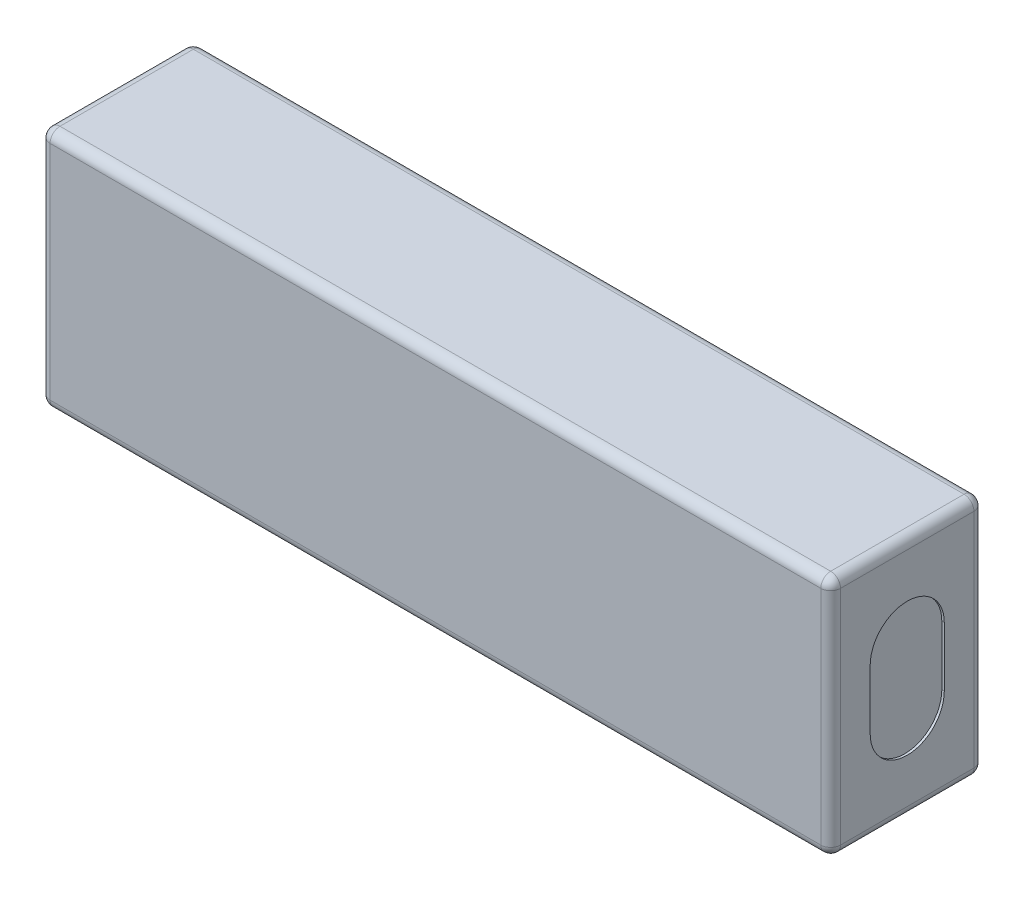
from build123d import *

# Parameters (mm, degrees)
ESBO_O1_W                = 160
ESBO_O1_H                = 49
RESSALTO_EXTRUS_O1_DEPTH = 15.5
CORTE_EXTRUS_O1_DEPTH    = 0.5
FILETE1_R                = 2


with BuildPart() as part:
    # Esboço1 → Ressalto-extrusão1 (new, symmetric)
    with BuildSketch(Plane.XY):
        Rectangle(ESBO_O1_W, ESBO_O1_H)
    extrude(amount=RESSALTO_EXTRUS_O1_DEPTH, both=True)

    # Esboço2 → Corte-extrusão1 (cut)
    with BuildSketch(Plane(origin=(80, 0, 0), x_dir=(0, 0, -1), z_dir=(1, 0, 0))):
        with BuildLine():
            Line((7.5, 6), (7.5, -6))
            ThreePointArc((7.5, -6), (0, -13.5), (-7.5, -6))
            Line((-7.5, -6), (-7.5, 6))
            ThreePointArc((-7.5, 6), (0, 13.5), (7.5, 6))
        make_face()
    corte_extrus_o1 = extrude(amount=-CORTE_EXTRUS_O1_DEPTH, mode=Mode.SUBTRACT)

    # Espelhar1: Corte-extrusão1 across plane
    add(corte_extrus_o1.mirror(Plane(origin=(0, 0, 0), x_dir=(0, 0, 1), z_dir=(1, 0, 0))), mode=Mode.SUBTRACT)

    # Filete1
    filete1_edges = [part.edges().sort_by_distance(p)[0] for p in [
        (-80, -24.5, 0),
        (80, -24.5, 0),
        (-80, 0, -15.5),
        (0, -24.5, -15.5),
        (80, 0, -15.5),
        (80, 24.5, 0),
        (-80, 24.5, 0),
        (0, 24.5, -15.5),
        (0, -24.5, 15.5),
        (-80, 0, 15.5),
        (0, 24.5, 15.5),
        (80, 0, 15.5),
    ]]
    fillet(filete1_edges, radius=FILETE1_R)


solid = part.part
